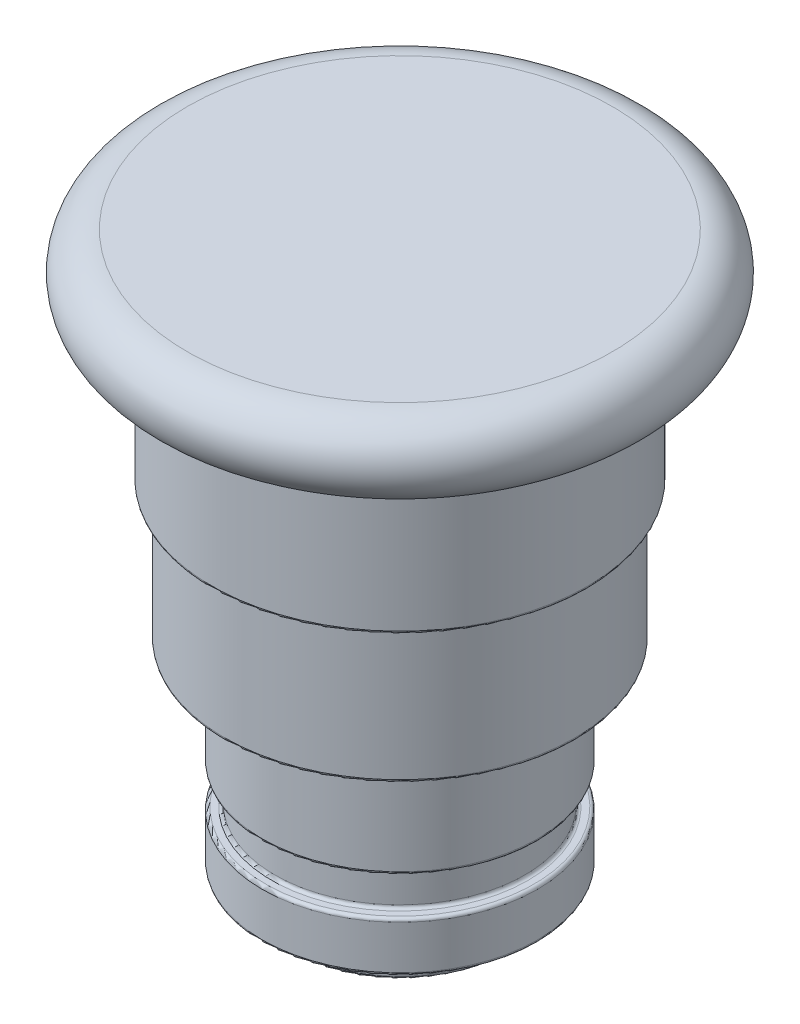
from build123d import *

# Parameters (mm, degrees)
CONG_1_R = 2
CONG_2_R = 0.25


with BuildPart() as part:
    # Esquisse1 → Révolution1 (revolve)
    with BuildSketch(Plane.XY):
        with BuildLine():
            Line((-11, 2), (-8.5, 2))
            Line((-8.5, 2), (-8.5, 0))
            Line((-8.5, 0), (0, 0))
            Line((0, 0), (0, 40))
            Line((0, 40), (0, 46))
            Line((0, 46), (-17, 46))
            ThreePointArc((-17, 46), (-20, 43), (-17, 40))
            Line((-17, 40), (-15, 40))
            Line((-15, 40), (-15, 28.5))
            Line((-15, 28.5), (-14, 28.5))
            Line((-14, 28.5), (-14, 17.5))
            Line((-14, 17.5), (-11, 17.5))
            Line((-11, 17.5), (-11, 9))
            Line((-11, 9), (-10, 9))
            Line((-10, 9), (-10, 6))
            Line((-10, 6), (-11, 6))
            Line((-11, 6), (-11, 2))
        make_face()
    revolve(axis=Axis((0, 40, 0), (0, -1, 0)))

    # Congé1
    cong_1_edges = [part.edges().sort_by_distance(p)[0] for p in [
        (15, 40, 0),
    ]]
    fillet(cong_1_edges, radius=CONG_1_R - 0.0001)  # a hair under: the kernel refuses the full size

    # Congé2
    cong_2_edges = [part.edges().sort_by_distance(p)[0] for p in [
        (8.5, 0, 0),
        (8.5, 2, 0),
        (11, 2, 0),
        (11, 6, 0),
        (10, 6, 0),
        (10, 9, 0),
        (11, 9, 0),
        (11, 17.5, 0),
        (14, 17.5, 0),
        (14, 28.5, 0),
        (15, 28.5, 0),
    ]]
    fillet(cong_2_edges, radius=CONG_2_R)


solid = part.part
